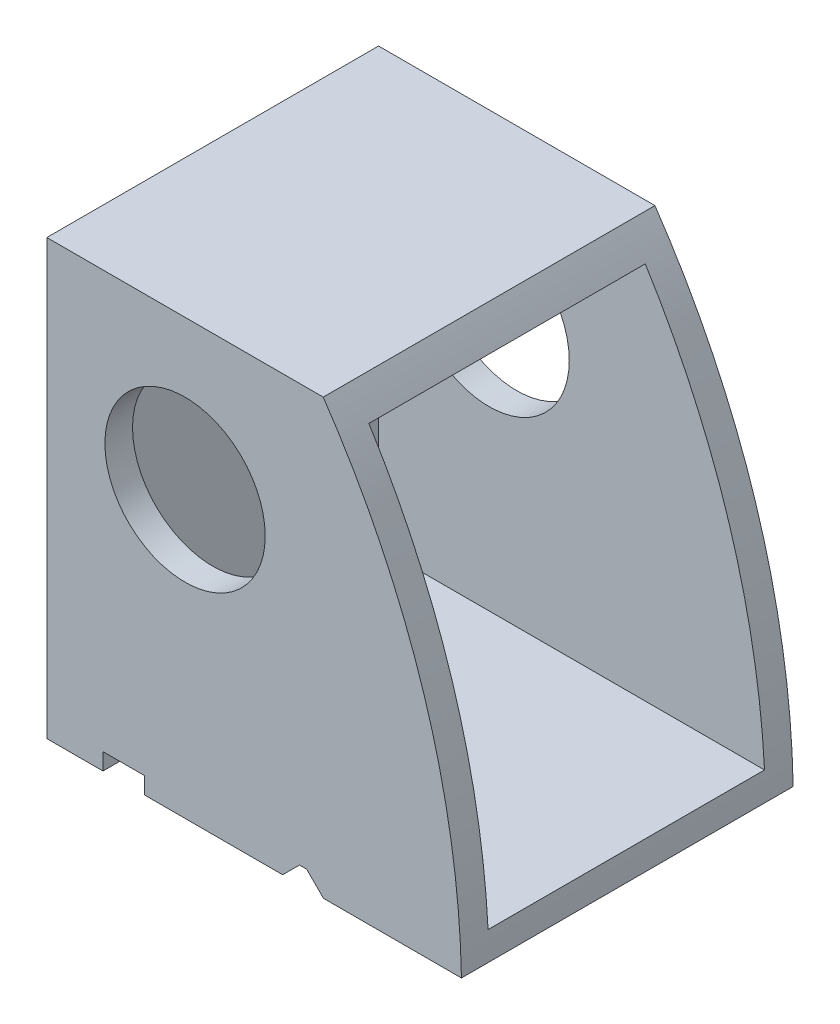
from build123d import *

# Parameters (mm, degrees)
BOSS_EXTRUDE1_DEPTH = 120
SHELL1_T            = -10
SKETCH2_R           = 29
CUT_EXTRUDE1_DEPTH  = 200
SKETCH3_W           = 15
SKETCH3_H           = 6.085201518
CUT_EXTRUDE2_DEPTH  = 200


with BuildPart() as part:
    # Sketch1 → Boss-Extrude1 (new body)
    with BuildSketch(Plane.XY):
        with BuildLine():
            Line((-10.096774194, 144.410679099), (89.903225806, 144.410679099))
            ThreePointArc((89.903225806, 144.410679099), (126.330854691, 69.550051356), (139.903225806, -12.589320901))
            Line((139.903225806, -12.589320901), (-10.096774194, -12.589320901))
            Line((-10.096774194, -12.589320901), (-10.096774194, 144.410679099))
        make_face()
    extrude(amount=BOSS_EXTRUDE1_DEPTH)

    # Shell1
    shell1_openings = [part.faces().sort_by_distance(p)[0] for p in [
        (126.330854691, 69.550051356, 60),
    ]]
    offset(amount=SHELL1_T, openings=shell1_openings, kind=Kind.INTERSECTION)

    # Sketch2 → Cut-Extrude1 (cut)
    with BuildSketch(Plane.XY.offset(120)):
        with Locations((39.903225806, 90.410679099)):
            Circle(SKETCH2_R)
    extrude(amount=-CUT_EXTRUDE1_DEPTH, mode=Mode.SUBTRACT)

    # Sketch3 → Cut-Extrude2 (cut)
    with BuildSketch(Plane.XY.offset(120)):
        Polygon((75.215541826, -12.589320901), (81.300743344, -6.504119383), (83.903225806, -6.504119383), (89.988427324, -12.589320901), align=None)
        with Locations((17.715541826, -9.546720142)):
            Rectangle(SKETCH3_W, SKETCH3_H)
    extrude(amount=-CUT_EXTRUDE2_DEPTH, mode=Mode.SUBTRACT)


solid = part.part
